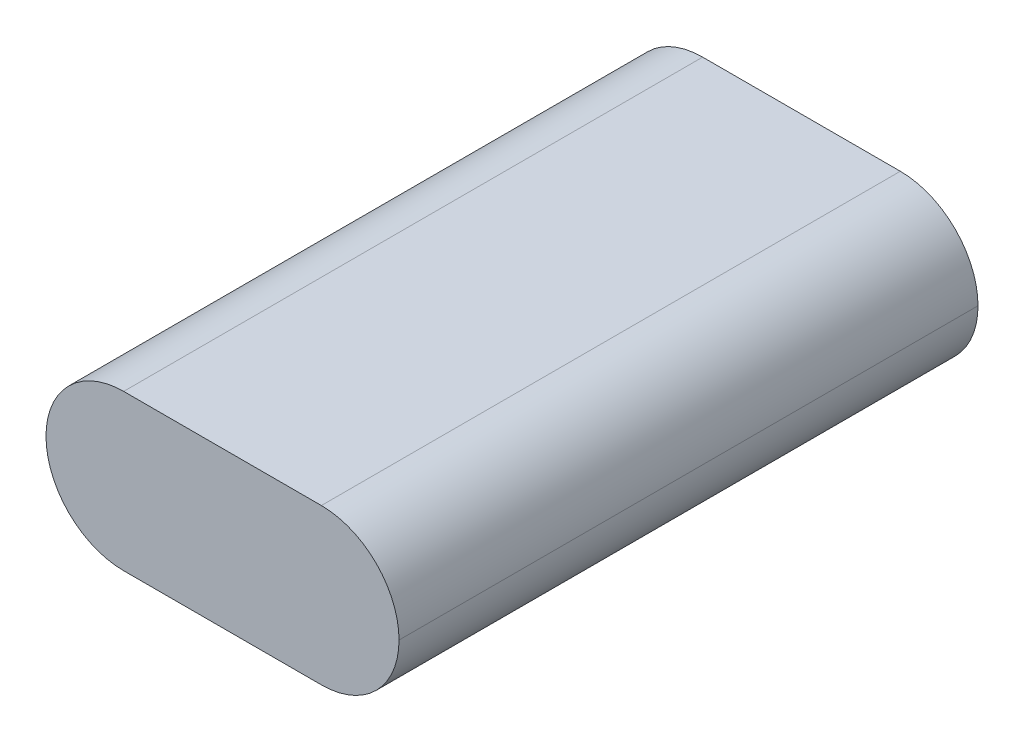
from build123d import *

# Parameters (mm, degrees)
SCHIZZO1_W                   = 25
SCHIZZO1_H                   = 41
ESTRUSIONE_ESTRUSIONE1_DEPTH = 11
RACCORDO1_R                  = 5.5


with BuildPart() as part:
    # Schizzo1 → Estrusione-Estrusione1 (new body)
    with BuildSketch(Plane(origin=(0, 0, 0), x_dir=(1, 0, 0), z_dir=(0, 1, 0))):
        with Locations((-12.5, 20.5)):
            Rectangle(SCHIZZO1_W, SCHIZZO1_H)
    extrude(amount=ESTRUSIONE_ESTRUSIONE1_DEPTH)

    # Raccordo1
    raccordo1_edges = [part.edges().sort_by_distance(p)[0] for p in [
        (-25, 11, -20.5),
        (-25, 0, -20.5),
        (0, 0, -20.5),
        (0, 11, -20.5),
    ]]
    fillet(raccordo1_edges, radius=RACCORDO1_R - 0.0001)  # a hair under: the kernel refuses the full size


solid = part.part
